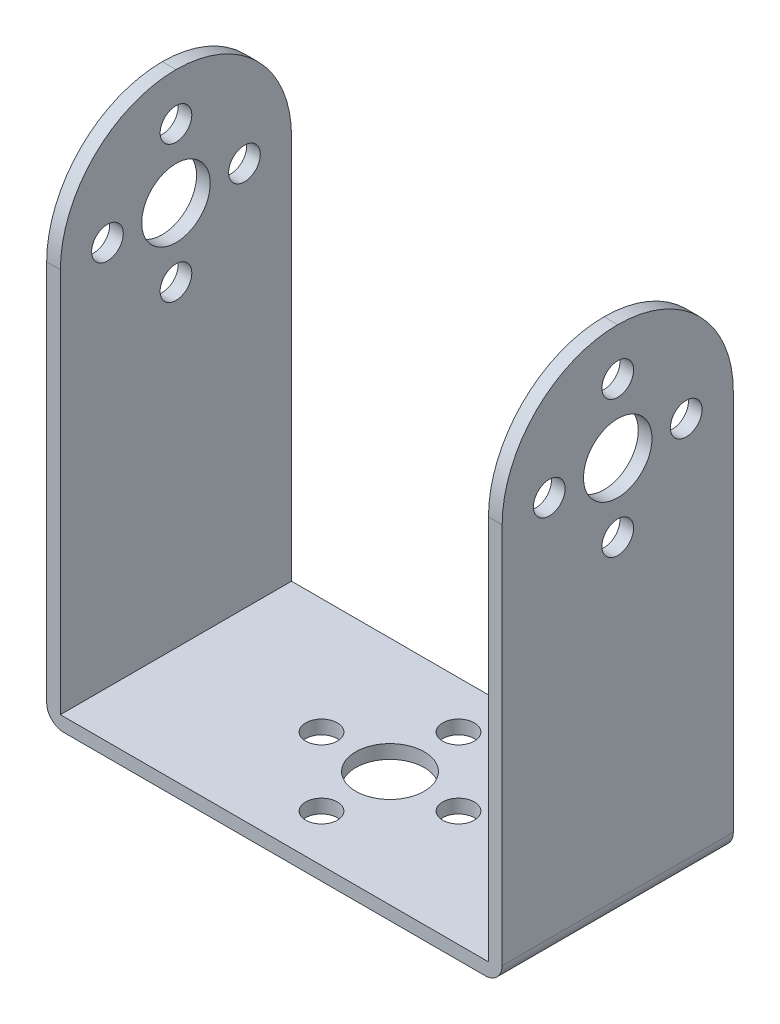
from build123d import *

# Parameters (mm, degrees)
EXTRUDE1_DEPTH           = 27
FILLET2_R                = 13.5
FILLET3_R                = 13.5
FILLET4_R                = 13.5
FILLET5_R                = 13.5
CUT_EXTRUDE1_START       = -53.2
CUT_EXTRUDE1_OUTLINE_R   = 4
CUT_EXTRUDE1_OUTLINE_R_2 = 1.85
CUT_EXTRUDE1_DEPTH       = 53.2
CUT_EXTRUDE2_START       = -1.6
CUT_EXTRUDE2_OUTLINE_R   = 4
CUT_EXTRUDE2_OUTLINE_R_2 = 1.85
CUT_EXTRUDE2_DEPTH       = 1.6
FILLET6_R                = 2
FILLET7_R                = 2


# Read off the part's stored shape, not the designer's step: Cut-Extrude1, Cut-Extrude2
with BuildPart() as part:
    # Sketch1 → Extrude1 (new body)
    with BuildSketch(Plane.XY):
        Polygon((0, 0), (53.2, 0), (53.2, 60.1), (51.6, 60.1), (51.6, 1.6), (1.6, 1.6), (1.6, 60.1), (0, 60.1), align=None)
    extrude(amount=-EXTRUDE1_DEPTH)

    # Fillet2
    fillet2_edges = [part.edges().sort_by_distance(p)[0] for p in [
        (52.4, 60.1, 0),
    ]]
    fillet(fillet2_edges, radius=FILLET2_R)

    # Fillet3
    fillet3_edges = [part.edges().sort_by_distance(p)[0] for p in [
        (52.4, 60.1, -27),
    ]]
    fillet(fillet3_edges, radius=FILLET3_R - 0.0001)  # a hair under: the kernel refuses the full size

    # Fillet4
    fillet4_edges = [part.edges().sort_by_distance(p)[0] for p in [
        (0.8, 60.1, -27),
    ]]
    fillet(fillet4_edges, radius=FILLET4_R)

    # Fillet5
    fillet5_edges = [part.edges().sort_by_distance(p)[0] for p in [
        (0.8, 60.1, 0),
    ]]
    fillet(fillet5_edges, radius=FILLET5_R - 0.0001)  # a hair under: the kernel refuses the full size

    # Cut-Extrude1 outline → Cut-Extrude1 (cut)
    with BuildSketch(Plane(origin=(53.2, 0, 0), x_dir=(0, 0, -1), z_dir=(1, 0, 0)).offset(CUT_EXTRUDE1_START)):
        with Locations((13.5, 46.6)):
            Circle(CUT_EXTRUDE1_OUTLINE_R)
        with Locations((21.5, 46.6)):
            Circle(CUT_EXTRUDE1_OUTLINE_R_2)
        with Locations((5.5, 46.6)):
            Circle(CUT_EXTRUDE1_OUTLINE_R_2)
        with Locations((13.5, 38.6)):
            Circle(CUT_EXTRUDE1_OUTLINE_R_2)
        with Locations((13.5, 54.6)):
            Circle(CUT_EXTRUDE1_OUTLINE_R_2)
    extrude(amount=CUT_EXTRUDE1_DEPTH, mode=Mode.SUBTRACT)

    # Cut-Extrude2 outline → Cut-Extrude2 (cut)
    with BuildSketch(Plane.XZ.offset(CUT_EXTRUDE2_START)):
        with Locations((26.6, -13.5)):
            Circle(CUT_EXTRUDE2_OUTLINE_R)
        with Locations((34.6, -13.5)):
            Circle(CUT_EXTRUDE2_OUTLINE_R_2)
        with Locations((18.6, -13.5)):
            Circle(CUT_EXTRUDE2_OUTLINE_R_2)
        with Locations((26.6, -21.5)):
            Circle(CUT_EXTRUDE2_OUTLINE_R_2)
        with Locations((26.6, -5.5)):
            Circle(CUT_EXTRUDE2_OUTLINE_R_2)
    extrude(amount=CUT_EXTRUDE2_DEPTH, mode=Mode.SUBTRACT)

    # Fillet6
    fillet6_edges = [part.edges().sort_by_distance(p)[0] for p in [
        (53.2, 0, -13.5),
    ]]
    fillet(fillet6_edges, radius=FILLET6_R)

    # Fillet7
    fillet7_edges = [part.edges().sort_by_distance(p)[0] for p in [
        (0, 0, -13.5),
    ]]
    fillet(fillet7_edges, radius=FILLET7_R)


solid = part.part
